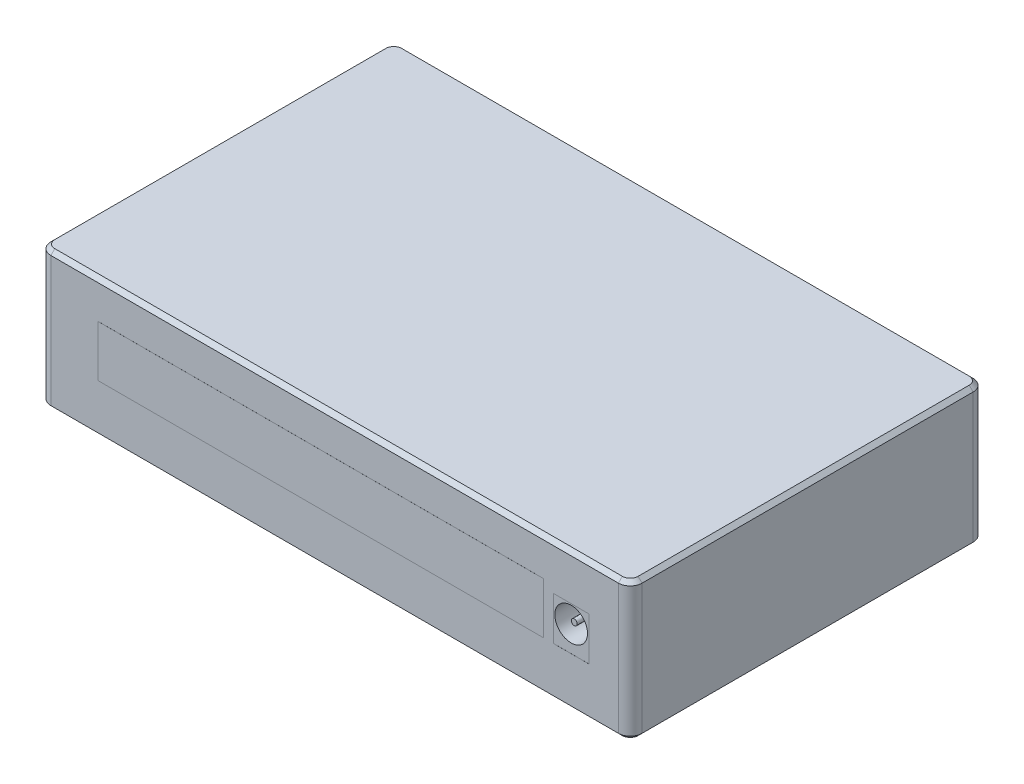
from build123d import *

# Parameters (mm, degrees)
SKETCH_1_W          = 150
SKETCH_1_H          = 90
EXTRUDE_1_DEPTH     = 35
SKETCH_2_R          = 5
EXTRUDE_2_DEPTH     = 1.8
FILLET_1_R          = 3
CHAMFER_1_SIZE      = 1
CHAMFER_2_SIZE      = 1.8
SKETCH_3_R          = 4.15
CUT_EXTRUDE_1_DEPTH = 5.8
SKETCH_4_R          = 0.75
EXTRUDE_3_DEPTH     = 5
CUT_EXTRUDE_2_DEPTH = 0.01
SKETCH_6_W          = 113
SKETCH_6_H          = 13
EXTRUDE_4_DEPTH     = 0.01


with BuildPart() as part:
    # 草图1 → 凸台-拉伸1 (new body)
    with BuildSketch(Plane(origin=(0, 0, 0), x_dir=(1, 0, 0), z_dir=(0, 1, 0))):
        with Locations((116.751230923, 45)):
            Rectangle(SKETCH_1_W, SKETCH_1_H)
    extrude(amount=EXTRUDE_1_DEPTH)

    # 草图2 → 凸台-拉伸2 (add)
    with BuildSketch(Plane.XZ):
        with Locations(Location((173.751230923, -18, 0), (0, 0, 90))):
            Circle(SKETCH_2_R)
        with Locations(Location((59.751230923, -18, 0), (0, 0, 90))):
            Circle(SKETCH_2_R)
        with Locations(Location((59.751230923, -72, 0), (0, 0, 90))):
            Circle(SKETCH_2_R)
        with Locations(Location((173.751230923, -72, 0), (0, 0, 90))):
            Circle(SKETCH_2_R)
    extrude(amount=EXTRUDE_2_DEPTH)

    # 圆角1
    fillet_1_edges = [part.edges().sort_by_distance(p)[0] for p in [
        (41.751230923, 17.5, -90),
        (191.751230923, 17.5, -90),
        (191.751230923, 17.5, 0),
        (41.751230923, 17.5, 0),
    ]]
    fillet(fillet_1_edges, radius=FILLET_1_R)

    # 倒角1
    chamfer_1_edges = [part.edges().sort_by_distance(p)[0] for p in [
        (191.751230923, 0, -45),
        (191.751230923, 35, -45),
        (41.751230923, 0, -45),
        (116.751230923, 0, -90),
        (116.751230923, 0, 0),
        (42.629910579, 0, -89.121320344),
        (42.629910579, 0, -0.878679656),
        (190.872551266, 0, -89.121320344),
        (190.872551266, 0, -0.878679656),
        (116.751230923, 35, 0),
        (41.751230923, 35, -45),
        (116.751230923, 35, -90),
        (42.629910579, 35, -89.121320344),
        (42.629910579, 35, -0.878679656),
        (190.872551266, 35, -89.121320344),
        (190.872551266, 35, -0.878679656),
    ]]
    chamfer(chamfer_1_edges, length=CHAMFER_1_SIZE)

    # 倒角2
    chamfer_2_edges = [part.edges().sort_by_distance(p)[0] for p in [
        (173.751230923, -1.8, -23),
        (59.751230923, -1.8, -23),
        (59.751230923, -1.8, -77),
        (173.751230923, -1.8, -77),
    ]]
    chamfer(chamfer_2_edges, length=CHAMFER_2_SIZE - 0.0001)  # a hair under: the kernel refuses the full size

    # 草图3 → 切除-拉伸1 (cut)
    with BuildSketch(Plane.XY):
        with Locations((176.751230923, 19)):
            Circle(SKETCH_3_R)
    extrude(amount=-CUT_EXTRUDE_1_DEPTH, mode=Mode.SUBTRACT)

    # 草图4 → 凸台-拉伸3 (add)
    with BuildSketch(Plane.XY.offset(-5.8)):
        with Locations((176.751230923, 19)):
            Circle(SKETCH_4_R)
    extrude(amount=EXTRUDE_3_DEPTH)

    # 草图5 → 切除-拉伸2 (cut)
    with BuildSketch(Plane.XY):
        Polygon((176.751230923, 23.5), (172.251230923, 23.5), (172.251230923, 12.5), (181.251230923, 12.5), (181.251230923, 23.5), align=None)
    extrude(amount=-CUT_EXTRUDE_2_DEPTH, mode=Mode.SUBTRACT)

    # 草图6 → 凸台-拉伸4 (add)
    with BuildSketch(Plane.XY):
        with Locations((113.251230923, 19)):
            Rectangle(SKETCH_6_W, SKETCH_6_H)
    extrude(amount=EXTRUDE_4_DEPTH)


solid = part.part
